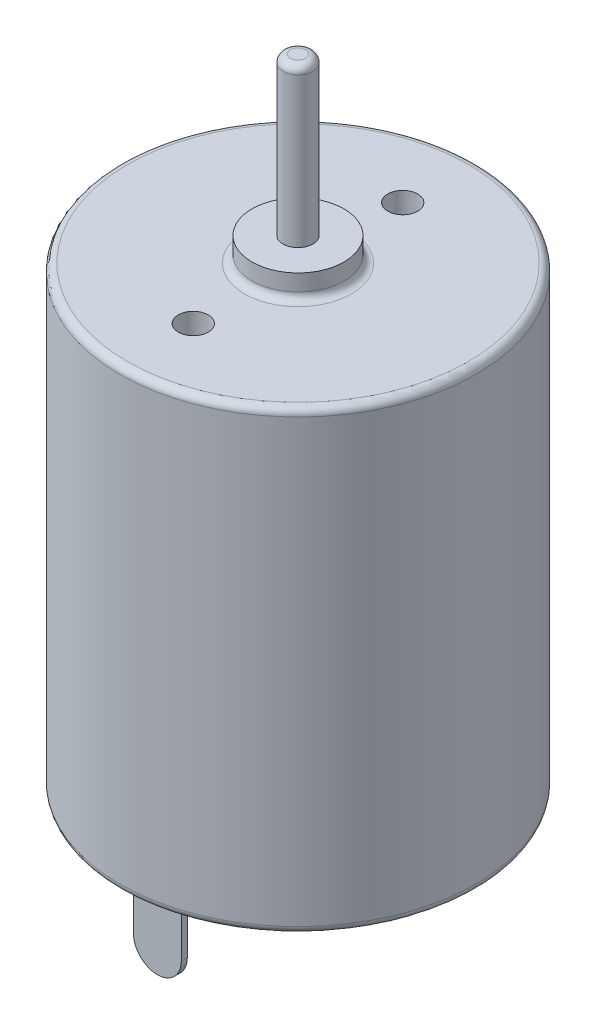
from build123d import *

# Parameters (mm, degrees)
SKETCH_1_R          = 11.9
EXTRUDE_1_DEPTH     = 30.5
EXTRUDE_2_DEPTH     = 1.5
EXTRUDE_3_DEPTH     = 6
CUT_EXTRUDE_1_DEPTH = 40.058289773
SKETCH_7_R          = 1
CUT_EXTRUDE_2_DEPTH = 5
SKETCH_8_R          = 3.075
EXTRUDE_4_DEPTH     = 1.6
SKETCH_9_R          = 1
EXTRUDE_5_DEPTH     = 10.5
FILLET_1_R          = 0.5
FILLET_2_R          = 0.5
FILLET_3_R          = 0.5


with BuildPart() as part:
    # 草圖1 → 填料-伸長1 (new body)
    with BuildSketch(Plane(origin=(0, 0, 0), x_dir=(1, 0, 0), z_dir=(0, 1, 0))):
        Circle(SKETCH_1_R)
    extrude(amount=EXTRUDE_1_DEPTH)

    # 草圖2 → 填料-伸長2 (add)
    with BuildSketch(Plane.XZ):
        with BuildLine():
            Line((3.75, -2), (3.75, 2))
            ThreePointArc((3.75, 2), (-4.25, 0), (3.75, -2))
        make_face()
    extrude(amount=EXTRUDE_2_DEPTH)

    # 草圖5 → 填料-伸長3 (add)
    with BuildSketch(Plane.XZ):
        Polygon((0, 9), (1.6, 9), (1.6, 9.4), (-1.6, 9.4), (-1.6, 9), align=None)
        Polygon((-1.6, -9.4), (1.6, -9.4), (1.6, -9), (0, -9), (-1.6, -9), align=None)
    extrude(amount=EXTRUDE_3_DEPTH)

    # 草圖6 → 除料-伸長1 (cut, through all)
    with BuildSketch(Plane(origin=(0, 0, -9.4), x_dir=(-1, 0, 0), z_dir=(0, 0, -1))):
        with BuildLine():
            ThreePointArc((0, -6), (-1.13137085, -5.53137085), (-1.6, -4.4))
            Line((-1.6, -4.4), (-1.6, -6))
            Line((-1.6, -6), (0, -6))
        make_face()
        with BuildLine():
            ThreePointArc((1.6, -4.4), (1.13137085, -5.53137085), (0, -6))
            Line((0, -6), (1.6, -6))
            Line((1.6, -6), (1.6, -4.4))
        make_face()
    extrude(amount=-CUT_EXTRUDE_1_DEPTH, mode=Mode.SUBTRACT)

    # 草圖7 → 除料-伸長2 (cut)
    with BuildSketch(Plane(origin=(0, 30.5, 0), x_dir=(1, 0, 0), z_dir=(0, 1, 0))):
        with Locations((0, 7)):
            Circle(SKETCH_7_R)
        with Locations((0, -7)):
            Circle(SKETCH_7_R)
    extrude(amount=-CUT_EXTRUDE_2_DEPTH, mode=Mode.SUBTRACT)

    # 草圖8 → 填料-伸長4 (add)
    with BuildSketch(Plane(origin=(0, 30.5, 0), x_dir=(1, 0, 0), z_dir=(0, 1, 0))):
        Circle(SKETCH_8_R)
    extrude(amount=EXTRUDE_4_DEPTH)

    # 草圖9 → 填料-伸長5 (add)
    with BuildSketch(Plane(origin=(0, 32.1, 0), x_dir=(1, 0, 0), z_dir=(0, 1, 0))):
        Circle(SKETCH_9_R)
    extrude(amount=EXTRUDE_5_DEPTH)

    # 圓角1
    fillet_1_edges = [part.edges().sort_by_distance(p)[0] for p in [
        (-3.075, 30.5, 0),
    ]]
    fillet(fillet_1_edges, radius=FILLET_1_R)

    # 圓角2
    fillet_2_edges = [part.edges().sort_by_distance(p)[0] for p in [
        (-11.9, 0, 0),
        (-11.9, 30.5, 0),
    ]]
    fillet(fillet_2_edges, radius=FILLET_2_R)

    # 圓角3
    fillet_3_edges = [part.edges().sort_by_distance(p)[0] for p in [
        (-1, 42.6, 0),
    ]]
    fillet(fillet_3_edges, radius=FILLET_3_R)


solid = part.part
